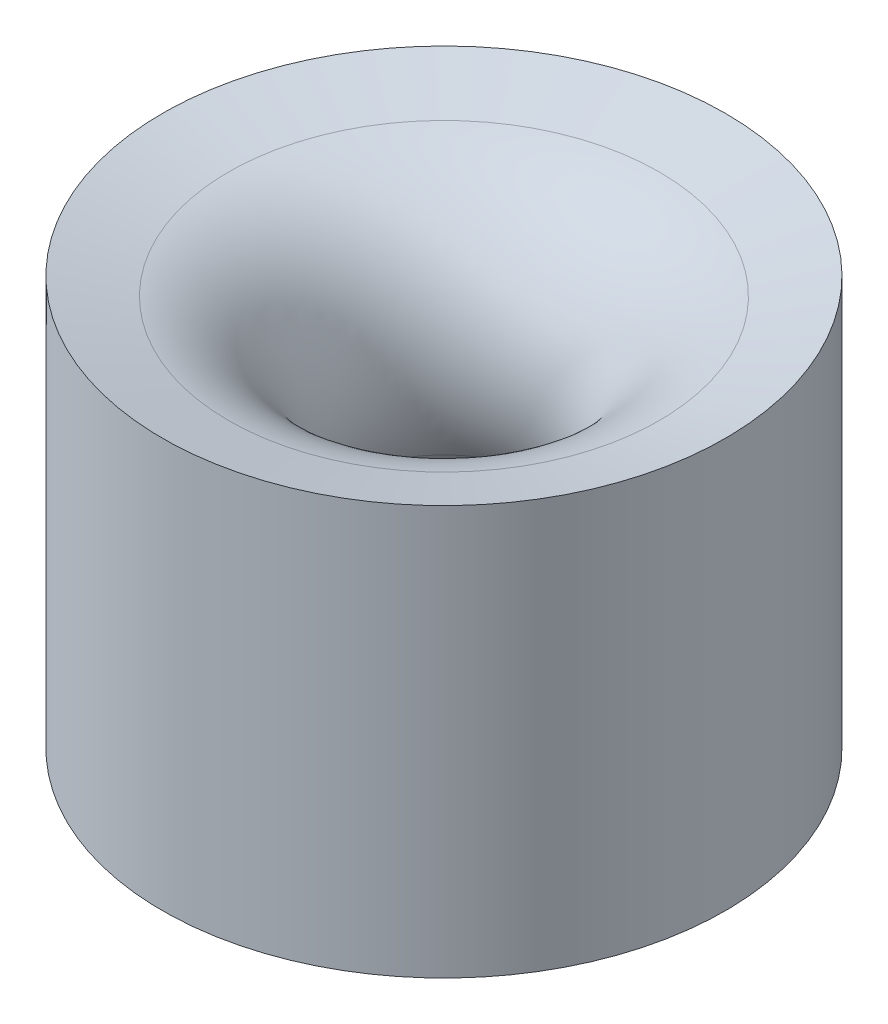
from build123d import *


with BuildPart() as part:
    # Sketch1 → Revolve1 (revolve)
    with BuildSketch(Plane.XY):
        with BuildLine():
            Line((41.275, 60), (41.275, 0))
            Line((41.275, 0), (28.559425877, 0))
            Line((28.559425877, 0), (16.684920898, 25.464958105))
            ThreePointArc((16.684920898, 25.464958105), (16.684920898, 44.905398145), (31.577161963, 57.40147213))
            Line((31.577161963, 57.40147213), (41.275, 60))
        make_face()
    revolve(axis=Axis((0, 11.203886574, 0), (0, 1, 0)))


solid = part.part
